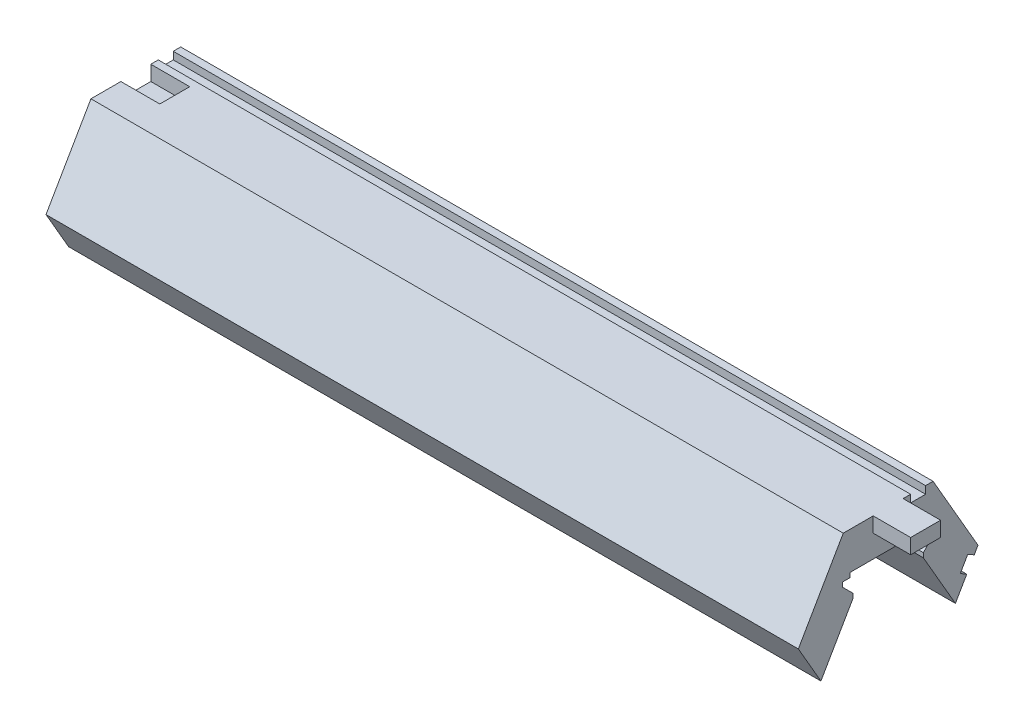
from build123d import *

# Parameters (mm, degrees)
BOSS_EXTRUDE2_DEPTH = 50.25
SKETCH3_W           = 2
SKETCH3_H           = 1
CUT_EXTRUDE2_DEPTH  = 102.746007293
SKETCH4_W           = 4
SKETCH4_H           = 2
BOSS_EXTRUDE3_DEPTH = 5
SKETCH5_W           = 4
SKETCH5_H           = 2
CUT_EXTRUDE3_DEPTH  = 5.2


with BuildPart() as part:
    # LED Segment → Boss-Extrude2 (new, symmetric)
    with BuildSketch(Plane(origin=(0, 0, 0), x_dir=(0, 0, -1), z_dir=(1, 0, 0))):
        Polygon((8.982863896, -5.225833025), (12, 0), (6, 10.392304845), (-6, 10.392304845), (-12, 0), (-8.982863896, -5.225833025), (-4.7, 2.192304845), (-4.7, 2.792304845), (-6.1, 4.192304845), (-6.1, 4.792304845), (-5.1, 4.792304845), (-5.1, 5.392304845), (5.1, 5.392304845), (5.1, 4.792304845), (6.1, 4.792304845), (6.1, 4.192304845), (4.7, 2.792304845), (4.7, 2.192304845), align=None)
    extrude(amount=BOSS_EXTRUDE2_DEPTH, both=True)

    # Sketch3 → Cut-Extrude2 (cut, through all)
    with BuildSketch(Plane(origin=(50.25, 0, 0), x_dir=(0, 0, -1), z_dir=(1, 0, 0))):
        with Locations((4, 9.892304845)):
            Rectangle(SKETCH3_W, SKETCH3_H)
        Polygon((10.5, -2.598076211), (11.5, -0.866025404), (10.633974596, -0.366025404), (9.633974596, -2.098076211), align=None)
    extrude(amount=-CUT_EXTRUDE2_DEPTH, mode=Mode.SUBTRACT)

    # Sketch4 → Boss-Extrude3 (add)
    with BuildSketch(Plane(origin=(50.25, 0, 0), x_dir=(0, 0, -1), z_dir=(1, 0, 0))):
        with Locations((0, 9.392304845)):
            Rectangle(SKETCH4_W, SKETCH4_H)
    extrude(amount=BOSS_EXTRUDE3_DEPTH)

    # Sketch5 → Cut-Extrude3 (cut)
    with BuildSketch(Plane.ZY.offset(50.25)):
        with Locations((0, 9.392304845)):
            Rectangle(SKETCH5_W, SKETCH5_H)
    extrude(amount=-CUT_EXTRUDE3_DEPTH, mode=Mode.SUBTRACT)


solid = part.part
